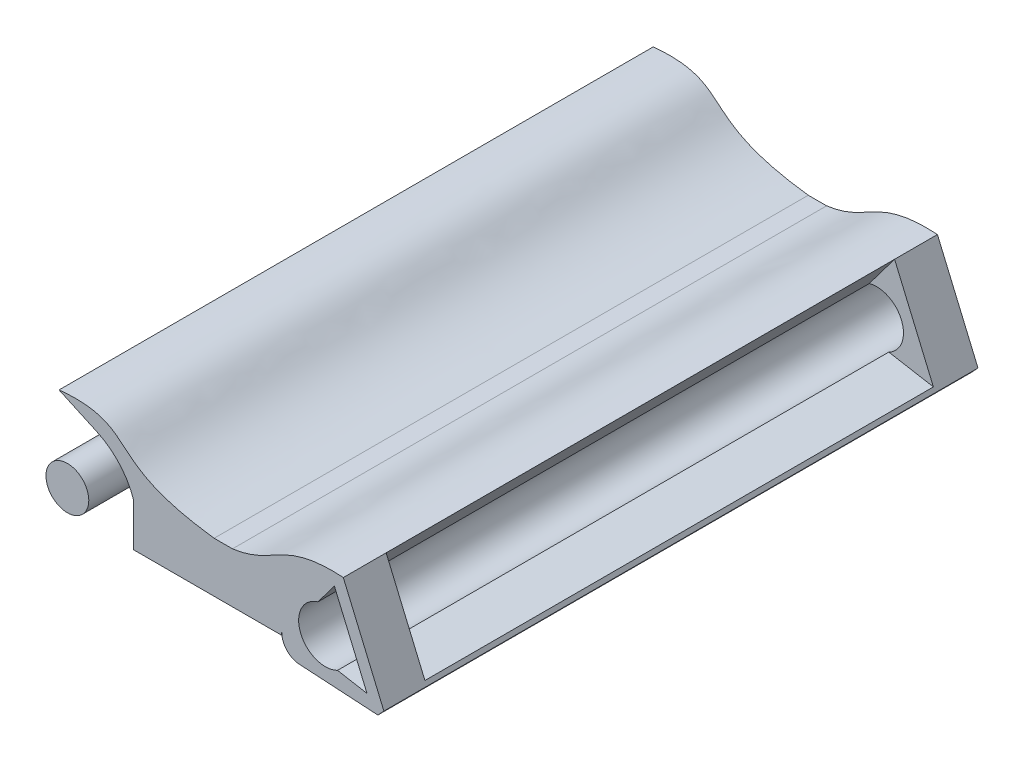
from build123d import *
from build123d.topology import SkipClean

# Parameters (mm, degrees)
BOSS_EXTRUDE1_DEPTH              = 55.49
BOSS_EXTRUDE5_DEPTH              = 4
BOSS_EXTRUDE6_START              = 51.49
BOSS_EXTRUDE6_DEPTH              = 4
BOSS_EXTRUDE7_START              = 5.6
BOSS_EXTRUDE7_DEPTH              = 44.29
SKETCH1_11_R                     = 2
BOSS_EXTRUDE8_DEPTH              = 55.59
BOSS_EXTRUDE9_DEPTH              = 55.49
BOSS_EXTRUDE10_REACH             = 60.551
SKETCH3_W                        = 44.29
SKETCH3_H                        = 4
BOSS_EXTRUDE11_START             = -49.89
BOSS_EXTRUDE11_DEPTH             = 55.49
CUT_EXTRUDE1_DEPTH               = 55.59
CUT_EXTRUDE1_DEPTH_BACK          = 55.59
BOSS_EXTRUDE12_DEPTH             = 49.59
BOSS_EXTRUDE12_DIRECTION_2_REACH = 60.225
BOSS_EXTRUDE13_DEPTH             = 4
BOSS_EXTRUDE14_START             = 55.49
BOSS_EXTRUDE14_DEPTH             = 4
BOSS_EXTRUDE15_DEPTH             = 0.3
CUT_EXTRUDE2_DEPTH               = 5.5
CUT_EXTRUDE3_START               = 55.49
CUT_EXTRUDE3_DEPTH               = 5.5
BOSS_EXTRUDE16_DEPTH             = 4
CUT_EXTRUDE4_DEPTH               = 5.5
CUT_EXTRUDE5_START               = -55.49
CUT_EXTRUDE5_DEPTH               = 5.5


# Read off the part's stored shape, not the designer's step: Boss-Extrude6
with BuildPart() as part:
    # Sketch1 → Boss-Extrude1 (new body)
    with BuildSketch(Plane.XY):
        with BuildLine():
            ThreePointArc((1.129915274, -2.230087773), (-2.325656227, -0.917236673), (-0.696579505, 2.400995001))
            Line((-0.696579505, 2.400995001), (0.839733193, 4.443342601))
            Line((0.839733193, 4.443342601), (1.672696268, 5.550669345))
            Line((1.672696268, 5.550669345), (-1.620002468, 5.749465478))
            Line((-1.620002468, 5.749465478), (-3.736897473, 3.873630853))
            Line((-3.736897473, 3.873630853), (-4.07142398, -1.667196274))
            ThreePointArc((-4.07142398, -1.667196274), (-3.634366728, -2.93327365), (-2.430068683, -3.519479403))
            Line((-2.430068683, -3.519479403), (4.898910437, -3.961965286))
            Line((4.898910437, -3.961965286), (5.462782558, -3.357258899))
            Line((5.462782558, -3.357258899), (5.295730888, -2.964633462))
            Line((5.295730888, -2.964633462), (3.885857643, -2.716034769))
            Line((3.885857643, -2.716034769), (1.129915274, -2.230087773))
        make_face()
    extrude(amount=BOSS_EXTRUDE1_DEPTH)

    # Sketch1<8> → Boss-Extrude5 (add)
    with BuildSketch(Plane.XY):
        Polygon((1.672696268, 5.550669345), (0.839733193, 4.443342601), (3.885857643, -2.716034769), (5.295730888, -2.964633462), align=None)
    extrude(amount=BOSS_EXTRUDE5_DEPTH)

    # Boss-Extrude6 outline → Boss-Extrude6 (add)
    with BuildSketch(Plane.XY.offset(BOSS_EXTRUDE6_START)):
        Polygon((3.885857643, -2.71603477), (5.295730888, -2.964633462), (1.672696268, 5.550669345), (0.839733193, 4.443342601), align=None)
    extrude(amount=BOSS_EXTRUDE6_DEPTH)


with BuildPart() as body_2:
    # Sketch1<10> → Boss-Extrude7 (new body)
    with BuildSketch(Plane.XY.offset(BOSS_EXTRUDE7_START)):
        with BuildLine():
            Line((0, -2), (12, -2))
            Line((12, -2), (12, 2))
            Line((12, 2), (0, 2))
            ThreePointArc((0, 2), (-2, 0), (0, -2))
        make_face()
    extrude(amount=BOSS_EXTRUDE7_DEPTH)

    # Sketch1<11> → Boss-Extrude8 (add)
    with BuildSketch(Plane.XY):
        Circle(SKETCH1_11_R)
    extrude(amount=BOSS_EXTRUDE8_DEPTH)


with BuildPart() as body_3:
    # Sketch1<12> → Boss-Extrude9 (new body)
    with BuildSketch(Plane.XY):
        with BuildLine():
            Line((22.5, 2), (20.149982379, 2))
            Line((20.149982379, 2), (19.92857602, -1.667196274))
            ThreePointArc((19.92857602, -1.667196274), (19.926466234, -1.833875846), (19.940224749, -2))
            Line((19.940224749, -2), (22.5, -2))
            ThreePointArc((22.5, -2), (21.5, 0), (22.5, 2))
        make_face()
        with BuildLine():
            Line((20.263102527, 3.873630853), (20.149982379, 2))
            Line((20.149982379, 2), (22.5, 2))
            ThreePointArc((22.5, 2), (22.883559394, 2.236863959), (23.303420495, 2.400995001))
            Line((23.303420495, 2.400995001), (24.839733193, 4.443342601))
            Line((24.839733193, 4.443342601), (25.672696268, 5.550669345))
            Line((25.672696268, 5.550669345), (22.379997532, 5.749465478))
            Line((22.379997532, 5.749465478), (20.263102527, 3.873630853))
        make_face()
        with BuildLine():
            Line((22.5, -2), (19.940224749, -2))
            ThreePointArc((19.940224749, -2), (20.482001684, -3.052625751), (21.569931317, -3.519479403))
            Line((21.569931317, -3.519479403), (28.898910437, -3.961965286))
            Line((28.898910437, -3.961965286), (29.462782558, -3.357258899))
            Line((29.462782558, -3.357258899), (29.295730888, -2.964633462))
            Line((29.295730888, -2.964633462), (27.885857643, -2.716034769))
            Line((27.885857643, -2.716034769), (25.129915274, -2.230087773))
            ThreePointArc((25.129915274, -2.230087773), (23.782110643, -2.490486745), (22.5, -2))
        make_face()
    extrude(amount=BOSS_EXTRUDE9_DEPTH)

    # Boss-Extrude10: up to this face of the body (flat: up to its plane)
    boss_extrude10_end = Plane(body_3.part.faces().sort_by_distance((20.095839274, 1.10321729, 27.745))[0])
    # Sketch3 → Boss-Extrude10 (add, up to the picked face)
    with BuildSketch(Plane(origin=(12, 0, 0), x_dir=(0, 0, -1), z_dir=(1, 0, 0)), mode=Mode.PRIVATE) as boss_extrude10_sk1:
        with Locations((-27.745, 0)):
            Rectangle(SKETCH3_W, SKETCH3_H)
    boss_extrude10_tool1 = split(extrude(boss_extrude10_sk1.sketch, amount=BOSS_EXTRUDE10_REACH, mode=Mode.PRIVATE), bisect_by=boss_extrude10_end, keep=Keep.BOTH, mode=Mode.PRIVATE)

    add(body_2.part)  # Boss-Extrude10 merges body 2
    add(boss_extrude10_tool1.solids().sort_by(Axis((12, 0, 27.745), (1, 0, 0)))[0])

    # Sketch4 → Boss-Extrude11 (add)
    with BuildSketch(Plane.XY.offset(49.89).offset(BOSS_EXTRUDE11_START)):
        with BuildLine():
            Line((20.263102527, 3.873630853), (25.672696268, 5.550669345))
            add(Edge.make_bspline(
                [(18.253064845, 3.63105347), (20.126675338, 4.576543011), (21.657010209, 5.806862999), (25.672696268, 5.550669345)],
                knots=[0.306550142, 0.306550142, 0.306550142, 0.306550142, 1, 1, 1, 1], degree=3))
            add(Edge.make_bspline(
                [(15.322676772, 2.697160199), (16.529464831, 2.850779242), (17.424806601, 3.213085323), (18.253064845, 3.63105347)],
                knots=[0, 0, 0, 0, 0.306550142, 0.306550142, 0.306550142, 0.306550142], degree=3))
            Line((15.322676772, 2.697160199), (13.609149986, 2.697160199))
            Line((13.609149986, 2.697160199), (13.609149986, 2))
            Line((13.609149986, 2), (0, 2))
            ThreePointArc((0, 2), (2, 0), (0, -2))
            Line((0, -2), (6.092058814, -2))
            Line((6.092058814, -2), (19.908483051, -2))
            Line((19.908483051, -2), (20.263102527, 3.873630853))
        make_face()
    extrude(amount=BOSS_EXTRUDE11_DEPTH)

    # Sketch4<5> → Cut-Extrude1 (cut, two sides: drawn at the far end of the back side and taken through both)
    with BuildSketch(Plane.XY.offset(49.89).offset(-CUT_EXTRUDE1_DEPTH_BACK)):
        with BuildLine():
            add(Edge.make_bspline(
                [(18.253064845, 3.63105347), (20.126675338, 4.576543011), (21.657010209, 5.806862999), (25.672696268, 5.550669345)],
                knots=[0.306550142, 0.306550142, 0.306550142, 0.306550142, 1, 1, 1, 1], degree=3))
            Line((25.672696268, 5.550669345), (19.033452373, 9.878906939))
            Line((19.033452373, 9.878906939), (18.253064845, 3.63105347))
        make_face()
    extrude(amount=CUT_EXTRUDE1_DEPTH + CUT_EXTRUDE1_DEPTH_BACK, mode=Mode.SUBTRACT)

    # Sketch4<6> → Boss-Extrude12 (add)
    with BuildSketch(Plane.XY.offset(49.89)):
        with BuildLine():
            Line((6.092058814, 2), (13.609149986, 2))
            Line((13.609149986, 2), (13.609149986, 2.697160199))
            add(Edge.make_bspline(
                [(13.609149986, 2.697160199), (3.008937487, 4.043912628), (6.643549935, 7.427073901), (2.231724762, 7.792821065), (-0.877126137, 7.449933099)],
                knots=[0, 0, 0, 0, 0, 1, 1, 1, 1, 1], degree=4))
            Line((-0.877126137, 7.449933099), (2.665214437, 5.830739223))
            ThreePointArc((2.665214437, 5.830739223), (4.778774076, 4.27366426), (6.091049818, 2))
            Line((6.091049818, 2), (6.092058814, 2))
        make_face()
    extrude(amount=-BOSS_EXTRUDE12_DEPTH)

    # Boss-Extrude12 direction 2: up to this face of the body (flat: up to its plane)
    boss_extrude12_direction_2_end = Plane(body_3.part.faces().sort_by_distance((14.730018873, 0.349949508, 55.49))[0])
    # Sketch4<6> → Boss-Extrude12 direction 2 (add, up to the picked face)
    with BuildSketch(Plane.XY.offset(49.89), mode=Mode.PRIVATE) as boss_extrude12_direction_2_sk1:
        with BuildLine():
            Line((6.092058814, 2), (13.609149986, 2))
            Line((13.609149986, 2), (13.609149986, 2.697160199))
            add(Edge.make_bspline(
                [(13.609149986, 2.697160199), (3.008937487, 4.043912628), (6.643549935, 7.427073901), (2.231724762, 7.792821065), (-0.877126137, 7.449933099)],
                knots=[0, 0, 0, 0, 0, 1, 1, 1, 1, 1], degree=4))
            Line((-0.877126137, 7.449933099), (2.665214437, 5.830739223))
            ThreePointArc((2.665214437, 5.830739223), (4.778774076, 4.27366426), (6.091049818, 2))
            Line((6.091049818, 2), (6.092058814, 2))
        make_face()
    boss_extrude12_direction_2_tool1 = split(extrude(boss_extrude12_direction_2_sk1.sketch, amount=BOSS_EXTRUDE12_DIRECTION_2_REACH, mode=Mode.PRIVATE), bisect_by=boss_extrude12_direction_2_end, keep=Keep.BOTH, mode=Mode.PRIVATE)
    add(boss_extrude12_direction_2_tool1.solids().sort_by(Axis((6.524615, 4.223787, 49.89), (0, 0, 1)))[0])

    # Sketch1<13> → Boss-Extrude13 (add)
    with BuildSketch(Plane.XY):
        Polygon((25.672696268, 5.550669345), (24.839733193, 4.443342601), (27.885857643, -2.716034769), (29.295730888, -2.964633462), align=None)
    extrude(amount=BOSS_EXTRUDE13_DEPTH)

    # Sketch1<14> → Boss-Extrude14 (add)
    with BuildSketch(Plane.XY.offset(BOSS_EXTRUDE14_START)):
        Polygon((25.672696268, 5.550669345), (24.839733193, 4.443342601), (27.885857643, -2.716034769), (29.295730888, -2.964633462), align=None)
    extrude(amount=-BOSS_EXTRUDE14_DEPTH)

    # Sketch5 → Boss-Extrude15 (add)
    with BuildSketch(Plane(origin=(0, 0, 0.3), x_dir=(-1, 0, 0), z_dir=(0, 0, -1))):
        with BuildLine():
            Line((-13.609149986, 2), (-6.091302067, 2))
            ThreePointArc((-6.091302067, 2), (-4.778900201, 4.273690642), (-2.665214437, 5.830739223))
            Line((-2.665214437, 5.830739223), (0.877126137, 7.449933099))
            add(Edge.make_bspline(
                [(0.877126137, 7.449933099), (-2.231724762, 7.792821065), (-6.643549935, 7.427073901), (-3.008937487, 4.043912628), (-13.609149986, 2.697160199)],
                knots=[0, 0, 0, 0, 0, 1, 1, 1, 1, 1], degree=4))
            Line((-13.609149986, 2.697160199), (-13.609149986, 2))
        make_face()
    extrude(amount=BOSS_EXTRUDE15_DEPTH)

    # Sketch1<15> → Cut-Extrude2 (cut)
    with SkipClean():  # the faces are left unmerged after this step: merging them gives an invalid solid
        with BuildSketch(Plane.XY):
            with BuildLine():
                Line((0, -2), (4.885305034, -2))
                Line((4.885305034, -2), (3.183411536, 2))
                Line((3.183411536, 2), (0, 2))
                ThreePointArc((0, 2), (2, 0), (0, -2))
            make_face()
        extrude(amount=CUT_EXTRUDE2_DEPTH, mode=Mode.SUBTRACT)

    # Sketch1<16> → Cut-Extrude3 (cut)
    with SkipClean():  # the faces are left unmerged after this step: merging them gives an invalid solid
        with BuildSketch(Plane.XY.offset(CUT_EXTRUDE3_START)):
            with BuildLine():
                Line((0, -2), (4.885305034, -2))
                Line((4.885305034, -2), (3.183411536, 2))
                Line((3.183411536, 2), (0, 2))
                ThreePointArc((0, 2), (2, 0), (0, -2))
            make_face()
        extrude(amount=-CUT_EXTRUDE3_DEPTH, mode=Mode.SUBTRACT)

    # Sketch1<17> → Boss-Extrude16 (add)
    with SkipClean():  # the faces are left unmerged after this step: merging them gives an invalid solid
        with BuildSketch(Plane.XY):
            with BuildLine():
                Line((24.839733193, 4.443342601), (23.303420495, 2.400995001))
                ThreePointArc((23.303420495, 2.400995001), (25.50142453, 1.998930809), (26.5, 0))
                ThreePointArc((26.5, 0), (26.499999366, -0.001781138), (26.499997462, -0.003562276))
                ThreePointArc((26.499997462, -0.003562276), (26.129183075, -1.310182978), (25.129915274, -2.230087773))
                Line((25.129915274, -2.230087773), (27.885857643, -2.716034769))
                Line((27.885857643, -2.716034769), (24.839733193, 4.443342601))
            make_face()
        extrude(amount=BOSS_EXTRUDE16_DEPTH)

    # Sketch6 → Cut-Extrude4 (cut)
    with SkipClean():  # the faces are left unmerged after this step: merging them gives an invalid solid
        with BuildSketch(Plane(origin=(0, 0, 0), x_dir=(-1, 0, 0), z_dir=(0, 0, -1))):
            Polygon((-3.183411536, 2), (-6.091302067, 2), (-6.091302067, -2), (-4.885305034, -2), align=None)
        extrude(amount=-CUT_EXTRUDE4_DEPTH, mode=Mode.SUBTRACT)

    # Sketch6<3> → Cut-Extrude5 (cut)
    with SkipClean():  # the faces are left unmerged after this step: merging them gives an invalid solid
        with BuildSketch(Plane(origin=(0, 0, 0), x_dir=(-1, 0, 0), z_dir=(0, 0, -1)).offset(CUT_EXTRUDE5_START)):
            Polygon((-3.183411536, 2), (-6.091302067, 2), (-6.091302067, -2), (-4.885305034, -2), align=None)
        extrude(amount=CUT_EXTRUDE5_DEPTH, mode=Mode.SUBTRACT)


solid = body_3.part
